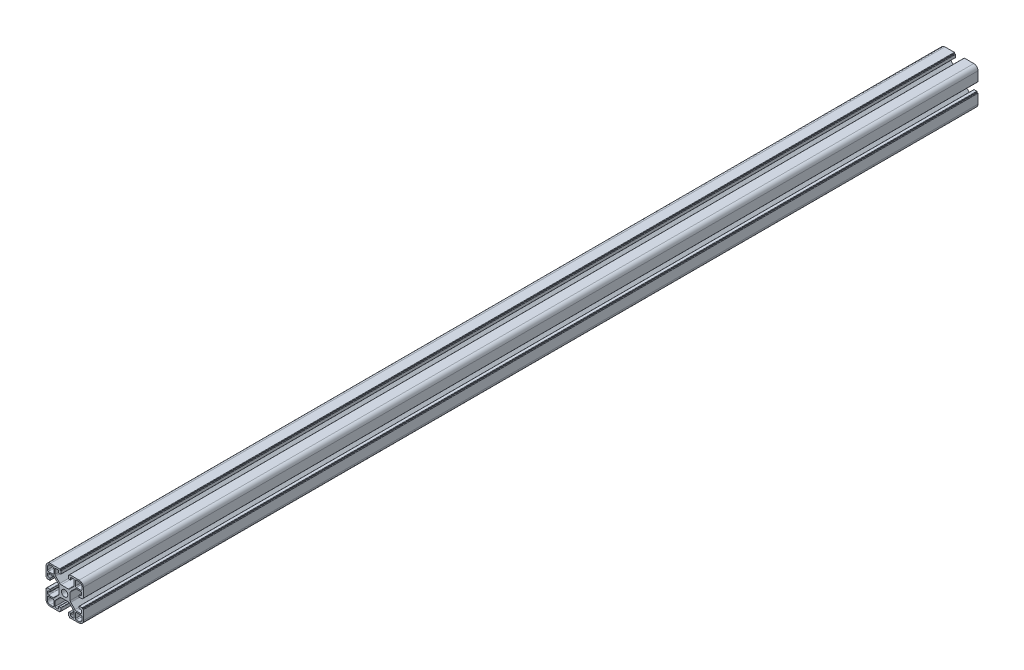
from build123d import *

# Parameters (mm, degrees)
SKETCH_1_R      = 3.4
EXTRUDE_1_DEPTH = 960


with BuildPart() as part:
    # 草图1 → 凸台-拉伸1 (new body)
    with BuildSketch(Plane.XY):
        with BuildLine():
            Line((5.1, -19.2), (5.1, -19.7))
            ThreePointArc((5.1, -19.7), (5.187867966, -19.912132034), (5.4, -20))
            Line((5.4, -20), (15.5, -20))
            ThreePointArc((15.5, -20), (18.681980515, -18.681980515), (20, -15.5))
            Line((20, -15.5), (20, -5.4))
            ThreePointArc((20, -5.4), (19.912132034, -5.187867966), (19.7, -5.1))
            Line((19.7, -5.1), (19.2, -5.1))
            ThreePointArc((19.2, -5.1), (19.058578644, -5.041421356), (19, -4.9))
            Line((19, -4.9), (19, -4.4))
            ThreePointArc((19, -4.4), (18.912132034, -4.187867966), (18.7, -4.1))
            Line((18.7, -4.1), (15.8, -4.1))
            ThreePointArc((15.8, -4.1), (15.587867966, -4.187867966), (15.5, -4.4))
            Line((15.5, -4.4), (15.5, -6.1))
            ThreePointArc((15.5, -6.1), (15.587867966, -6.312132034), (15.8, -6.4))
            Line((15.8, -6.4), (17.2, -6.4))
            ThreePointArc((17.2, -6.4), (17.907106781, -6.692893219), (18.2, -7.4))
            Line((18.2, -7.4), (18.2, -9.25))
            ThreePointArc((18.2, -9.25), (17.907106781, -9.957106781), (17.2, -10.25))
            Line((17.2, -10.25), (12.492640687, -10.25))
            ThreePointArc((12.492640687, -10.25), (11.727273822, -10.097759065), (11.078427125, -9.664213562))
            Line((11.078427125, -9.664213562), (6.585786438, -5.171572875))
            ThreePointArc((6.585786438, -5.171572875), (6.152240935, -4.522726178), (6, -3.757359313))
            Line((6, -3.757359313), (6, 3.757359313))
            ThreePointArc((6, 3.757359313), (6.152240935, 4.522726178), (6.585786438, 5.171572875))
            Line((6.585786438, 5.171572875), (11.078427125, 9.664213562))
            ThreePointArc((11.078427125, 9.664213562), (11.727273822, 10.097759065), (12.492640687, 10.25))
            Line((12.492640687, 10.25), (17.2, 10.25))
            ThreePointArc((17.2, 10.25), (17.907106781, 9.957106781), (18.2, 9.25))
            Line((18.2, 9.25), (18.2, 7.4))
            ThreePointArc((18.2, 7.4), (17.907106781, 6.692893219), (17.2, 6.4))
            Line((17.2, 6.4), (15.8, 6.4))
            ThreePointArc((15.8, 6.4), (15.587867966, 6.312132034), (15.5, 6.1))
            Line((15.5, 6.1), (15.5, 4.4))
            ThreePointArc((15.5, 4.4), (15.587867966, 4.187867966), (15.8, 4.1))
            Line((15.8, 4.1), (18.7, 4.1))
            ThreePointArc((18.7, 4.1), (18.912132034, 4.187867966), (19, 4.4))
            Line((19, 4.4), (19, 4.9))
            ThreePointArc((19, 4.9), (19.058578644, 5.041421356), (19.2, 5.1))
            Line((19.2, 5.1), (19.7, 5.1))
            ThreePointArc((19.7, 5.1), (19.912132034, 5.187867966), (20, 5.4))
            Line((20, 5.4), (20, 15.5))
            ThreePointArc((20, 15.5), (18.681980515, 18.681980515), (15.5, 20))
            Line((15.5, 20), (5.4, 20))
            ThreePointArc((5.4, 20), (5.187867966, 19.912132034), (5.1, 19.7))
            Line((5.1, 19.7), (5.1, 19.2))
            ThreePointArc((5.1, 19.2), (5.041421356, 19.058578644), (4.9, 19))
            Line((4.9, 19), (4.4, 19))
            ThreePointArc((4.4, 19), (4.187867966, 18.912132034), (4.1, 18.7))
            Line((4.1, 18.7), (4.1, 15.8))
            ThreePointArc((4.1, 15.8), (4.187867966, 15.587867966), (4.4, 15.5))
            Line((4.4, 15.5), (6.1, 15.5))
            ThreePointArc((6.1, 15.5), (6.312132034, 15.587867966), (6.4, 15.8))
            Line((6.4, 15.8), (6.4, 17.2))
            ThreePointArc((6.4, 17.2), (6.692893219, 17.907106781), (7.4, 18.2))
            Line((7.4, 18.2), (9.25, 18.2))
            ThreePointArc((9.25, 18.2), (9.957106781, 17.907106781), (10.25, 17.2))
            Line((10.25, 17.2), (10.25, 12.492640687))
            ThreePointArc((10.25, 12.492640687), (10.097759065, 11.727273822), (9.664213562, 11.078427125))
            Line((9.664213562, 11.078427125), (5.171572875, 6.585786438))
            ThreePointArc((5.171572875, 6.585786438), (4.522726178, 6.152240935), (3.757359313, 6))
            Line((3.757359313, 6), (-3.757359313, 6))
            ThreePointArc((-3.757359313, 6), (-4.522726178, 6.152240935), (-5.171572875, 6.585786438))
            Line((-5.171572875, 6.585786438), (-9.664213562, 11.078427125))
            ThreePointArc((-9.664213562, 11.078427125), (-10.097759065, 11.727273822), (-10.25, 12.492640687))
            Line((-10.25, 12.492640687), (-10.25, 17.2))
            ThreePointArc((-10.25, 17.2), (-9.957106781, 17.907106781), (-9.25, 18.2))
            Line((-9.25, 18.2), (-7.4, 18.2))
            ThreePointArc((-7.4, 18.2), (-6.692893219, 17.907106781), (-6.4, 17.2))
            Line((-6.4, 17.2), (-6.4, 15.8))
            ThreePointArc((-6.4, 15.8), (-6.312132034, 15.587867966), (-6.1, 15.5))
            Line((-6.1, 15.5), (-4.4, 15.5))
            ThreePointArc((-4.4, 15.5), (-4.187867966, 15.587867966), (-4.1, 15.8))
            Line((-4.1, 15.8), (-4.1, 18.7))
            ThreePointArc((-4.1, 18.7), (-4.187867966, 18.912132034), (-4.4, 19))
            Line((-4.4, 19), (-4.9, 19))
            ThreePointArc((-4.9, 19), (-5.041421356, 19.058578644), (-5.1, 19.2))
            Line((-5.1, 19.2), (-5.1, 19.7))
            ThreePointArc((-5.1, 19.7), (-5.187867966, 19.912132034), (-5.4, 20))
            Line((-5.4, 20), (-15.5, 20))
            ThreePointArc((-15.5, 20), (-18.681980515, 18.681980515), (-20, 15.5))
            Line((-20, 15.5), (-20, 5.4))
            ThreePointArc((-20, 5.4), (-19.912132034, 5.187867966), (-19.7, 5.1))
            Line((-19.7, 5.1), (-19.2, 5.1))
            ThreePointArc((-19.2, 5.1), (-19.058578644, 5.041421356), (-19, 4.9))
            Line((-19, 4.9), (-19, 4.4))
            ThreePointArc((-19, 4.4), (-18.912132034, 4.187867966), (-18.7, 4.1))
            Line((-18.7, 4.1), (-15.8, 4.1))
            ThreePointArc((-15.8, 4.1), (-15.587867966, 4.187867966), (-15.5, 4.4))
            Line((-15.5, 4.4), (-15.5, 6.1))
            ThreePointArc((-15.5, 6.1), (-15.587867966, 6.312132034), (-15.8, 6.4))
            Line((-15.8, 6.4), (-17.2, 6.4))
            ThreePointArc((-17.2, 6.4), (-17.907106781, 6.692893219), (-18.2, 7.4))
            Line((-18.2, 7.4), (-18.2, 9.25))
            ThreePointArc((-18.2, 9.25), (-17.907106781, 9.957106781), (-17.2, 10.25))
            Line((-17.2, 10.25), (-12.492640687, 10.25))
            ThreePointArc((-12.492640687, 10.25), (-11.727273822, 10.097759065), (-11.078427125, 9.664213562))
            Line((-11.078427125, 9.664213562), (-6.585786438, 5.171572875))
            ThreePointArc((-6.585786438, 5.171572875), (-6.152240935, 4.522726178), (-6, 3.757359313))
            Line((-6, 3.757359313), (-6, -3.757359313))
            ThreePointArc((-6, -3.757359313), (-6.152240935, -4.522726178), (-6.585786438, -5.171572875))
            Line((-6.585786438, -5.171572875), (-11.078427125, -9.664213562))
            ThreePointArc((-11.078427125, -9.664213562), (-11.727273822, -10.097759065), (-12.492640687, -10.25))
            Line((-12.492640687, -10.25), (-17.2, -10.25))
            ThreePointArc((-17.2, -10.25), (-17.907106781, -9.957106781), (-18.2, -9.25))
            Line((-18.2, -9.25), (-18.2, -7.4))
            ThreePointArc((-18.2, -7.4), (-17.907106781, -6.692893219), (-17.2, -6.4))
            Line((-17.2, -6.4), (-15.8, -6.4))
            ThreePointArc((-15.8, -6.4), (-15.587867966, -6.312132034), (-15.5, -6.1))
            Line((-15.5, -6.1), (-15.5, -4.4))
            ThreePointArc((-15.5, -4.4), (-15.587867966, -4.187867966), (-15.8, -4.1))
            Line((-15.8, -4.1), (-18.7, -4.1))
            ThreePointArc((-18.7, -4.1), (-18.912132034, -4.187867966), (-19, -4.4))
            Line((-19, -4.4), (-19, -4.9))
            ThreePointArc((-19, -4.9), (-19.058578644, -5.041421356), (-19.2, -5.1))
            Line((-19.2, -5.1), (-19.7, -5.1))
            ThreePointArc((-19.7, -5.1), (-19.912132034, -5.187867966), (-20, -5.4))
            Line((-20, -5.4), (-20, -15.5))
            ThreePointArc((-20, -15.5), (-18.681980515, -18.681980515), (-15.5, -20))
            Line((-15.5, -20), (-5.4, -20))
            ThreePointArc((-5.4, -20), (-5.187867966, -19.912132034), (-5.1, -19.7))
            Line((-5.1, -19.7), (-5.1, -19.2))
            ThreePointArc((-5.1, -19.2), (-5.041421356, -19.058578644), (-4.9, -19))
            Line((-4.9, -19), (-4.4, -19))
            ThreePointArc((-4.4, -19), (-4.201259622, -18.973110567), (-4.1, -18.8))
            Line((-4.1, -18.8), (-4.1, -15.8))
            ThreePointArc((-4.1, -15.8), (-4.187867966, -15.587867966), (-4.4, -15.5))
            Line((-4.4, -15.5), (-6.1, -15.5))
            ThreePointArc((-6.1, -15.5), (-6.312132034, -15.587867966), (-6.4, -15.8))
            Line((-6.4, -15.8), (-6.4, -17.2))
            ThreePointArc((-6.4, -17.2), (-6.692893219, -17.907106781), (-7.4, -18.2))
            Line((-7.4, -18.2), (-9.25, -18.2))
            ThreePointArc((-9.25, -18.2), (-9.957106781, -17.907106781), (-10.25, -17.2))
            Line((-10.25, -17.2), (-10.25, -12.492640687))
            ThreePointArc((-10.25, -12.492640687), (-10.097759065, -11.727273822), (-9.664213562, -11.078427125))
            Line((-9.664213562, -11.078427125), (-5.171572875, -6.585786438))
            ThreePointArc((-5.171572875, -6.585786438), (-4.522726178, -6.152240935), (-3.757359313, -6))
            Line((-3.757359313, -6), (3.757359313, -6))
            ThreePointArc((3.757359313, -6), (4.522726178, -6.152240935), (5.171572875, -6.585786438))
            Line((5.171572875, -6.585786438), (9.664213562, -11.078427125))
            ThreePointArc((9.664213562, -11.078427125), (10.097759065, -11.727273822), (10.25, -12.492640687))
            Line((10.25, -12.492640687), (10.25, -17.2))
            ThreePointArc((10.25, -17.2), (9.957106781, -17.907106781), (9.25, -18.2))
            Line((9.25, -18.2), (7.4, -18.2))
            ThreePointArc((7.4, -18.2), (6.692893219, -17.907106781), (6.4, -17.2))
            Line((6.4, -17.2), (6.4, -15.8))
            ThreePointArc((6.4, -15.8), (6.312132034, -15.587867966), (6.1, -15.5))
            Line((6.1, -15.5), (4.4, -15.5))
            ThreePointArc((4.4, -15.5), (4.187867966, -15.587867966), (4.1, -15.8))
            Line((4.1, -15.8), (4.1, -18.8))
            ThreePointArc((4.1, -18.8), (4.201259622, -18.973110567), (4.4, -19))
            Line((4.4, -19), (4.9, -19))
            ThreePointArc((4.9, -19), (5.041421356, -19.058578644), (5.1, -19.2))
        make_face()
        Circle(SKETCH_1_R, mode=Mode.SUBTRACT)
        with BuildLine():
            Line((12.55, 18.5), (15.5, 18.5))
            ThreePointArc((15.5, 18.5), (17.621320344, 17.621320344), (18.5, 15.5))
            Line((18.5, 15.5), (18.5, 12.55))
            ThreePointArc((18.5, 12.55), (18.207106781, 11.842893219), (17.5, 11.55))
            Line((17.5, 11.55), (12.55, 11.55))
            ThreePointArc((12.55, 11.55), (11.842893219, 11.842893219), (11.55, 12.55))
            Line((11.55, 12.55), (11.55, 17.5))
            ThreePointArc((11.55, 17.5), (11.842893219, 18.207106781), (12.55, 18.5))
        make_face(mode=Mode.SUBTRACT)
        with BuildLine():
            Line((-11.55, 17.5), (-11.55, 12.55))
            ThreePointArc((-11.55, 12.55), (-11.842893219, 11.842893219), (-12.55, 11.55))
            Line((-12.55, 11.55), (-17.5, 11.55))
            ThreePointArc((-17.5, 11.55), (-18.207106781, 11.842893219), (-18.5, 12.55))
            Line((-18.5, 12.55), (-18.5, 15.5))
            ThreePointArc((-18.5, 15.5), (-17.621320344, 17.621320344), (-15.5, 18.5))
            Line((-15.5, 18.5), (-12.55, 18.5))
            ThreePointArc((-12.55, 18.5), (-11.842893219, 18.207106781), (-11.55, 17.5))
        make_face(mode=Mode.SUBTRACT)
        with BuildLine():
            Line((-12.55, -18.5), (-15.5, -18.5))
            ThreePointArc((-15.5, -18.5), (-17.621320344, -17.621320344), (-18.5, -15.5))
            Line((-18.5, -15.5), (-18.5, -12.55))
            ThreePointArc((-18.5, -12.55), (-18.207106781, -11.842893219), (-17.5, -11.55))
            Line((-17.5, -11.55), (-12.55, -11.55))
            ThreePointArc((-12.55, -11.55), (-11.842893219, -11.842893219), (-11.55, -12.55))
            Line((-11.55, -12.55), (-11.55, -17.5))
            ThreePointArc((-11.55, -17.5), (-11.842893219, -18.207106781), (-12.55, -18.5))
        make_face(mode=Mode.SUBTRACT)
        with BuildLine():
            Line((11.55, -17.5), (11.55, -12.55))
            ThreePointArc((11.55, -12.55), (11.842893219, -11.842893219), (12.55, -11.55))
            Line((12.55, -11.55), (17.5, -11.55))
            ThreePointArc((17.5, -11.55), (18.207106781, -11.842893219), (18.5, -12.55))
            Line((18.5, -12.55), (18.5, -15.5))
            ThreePointArc((18.5, -15.5), (17.621320344, -17.621320344), (15.5, -18.5))
            Line((15.5, -18.5), (12.55, -18.5))
            ThreePointArc((12.55, -18.5), (11.842893219, -18.207106781), (11.55, -17.5))
        make_face(mode=Mode.SUBTRACT)
    extrude(amount=EXTRUDE_1_DEPTH)


solid = part.part
